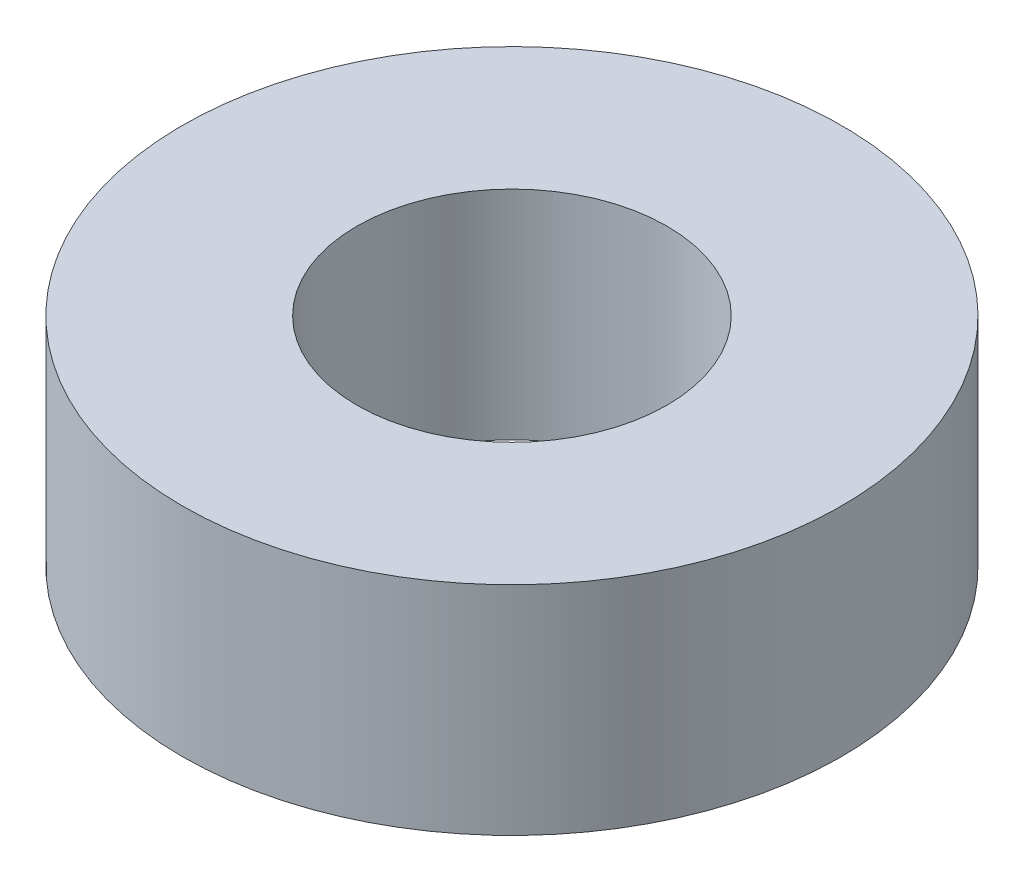
from build123d import *

# Parameters (mm, degrees)
SKETCH1_R           = 42.5
BOSS_EXTRUDE1_DEPTH = 28
SKETCH2_R           = 20
CUT_EXTRUDE1_DEPTH  = 67.306108316


with BuildPart() as part:
    # Sketch1 → Boss-Extrude1 (new body)
    with BuildSketch(Plane(origin=(0, 0, 0), x_dir=(1, 0, 0), z_dir=(0, 1, 0))):
        Circle(SKETCH1_R)
    extrude(amount=BOSS_EXTRUDE1_DEPTH)

    # Sketch2 → Cut-Extrude1 (cut, through all)
    with BuildSketch(Plane(origin=(0, 0, 0), x_dir=(1, 0, 0), z_dir=(0, 1, 0))):
        Circle(SKETCH2_R)
    extrude(amount=CUT_EXTRUDE1_DEPTH, mode=Mode.SUBTRACT)


solid = part.part
